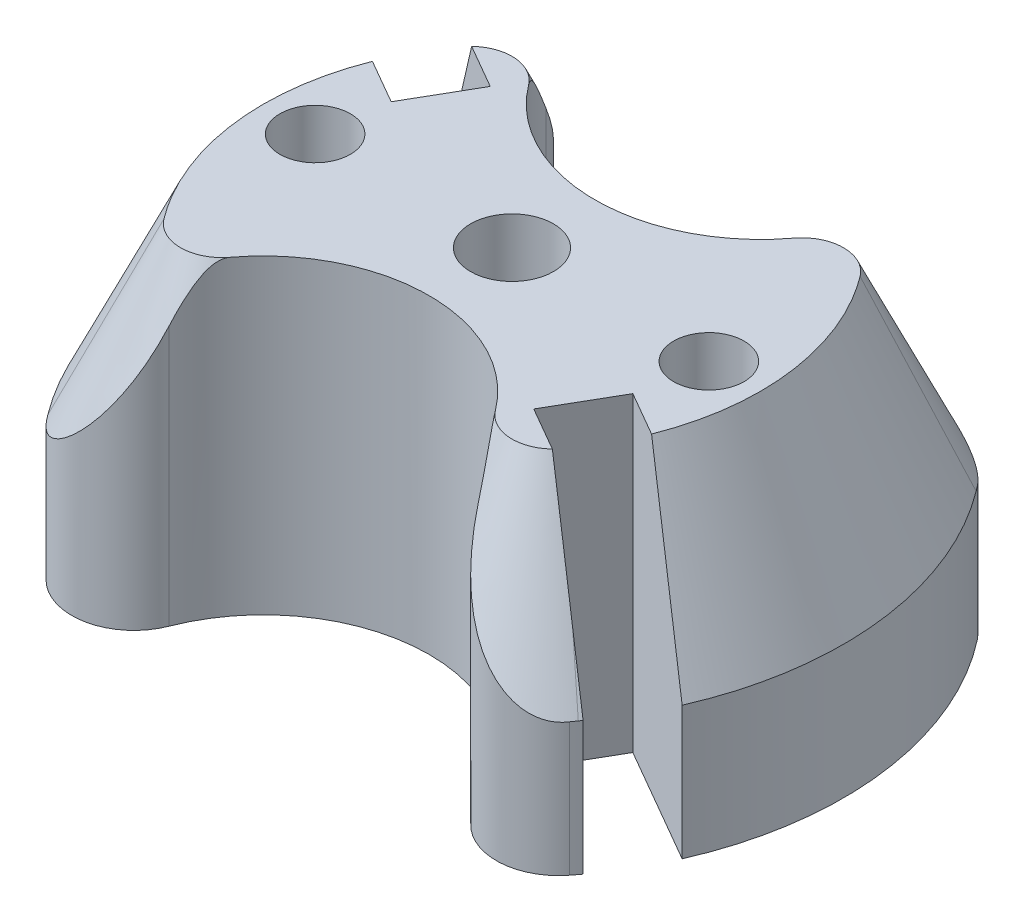
from build123d import *

# Parameters (mm, degrees)
BOSS_EXTRUDE1_DEPTH = 15
BOSS_EXTRUDE1_TAPER = -25
SKETCH2_R           = 2
CUT_EXTRUDE1_DEPTH  = 17
SKETCH3_R           = 32.062922841
CUT_EXTRUDE2_DEPTH  = 29.471632885
SKETCH1_3_R         = 1.7
CUT_EXTRUDE3_DEPTH  = 13


with BuildPart() as part:
    # Sketch1 → Boss-Extrude1 (new body)
    with BuildSketch(Plane(origin=(0, 0, 0), x_dir=(1, 0, 0), z_dir=(0, 1, 0))):
        with BuildLine():
            ThreePointArc((6.4, 7.2), (0, 4), (-6.4, 7.2))
            ThreePointArc((-6.4, 7.2), (-8, 8), (-9.6, 7.2))
            add(Edge.make_bspline(
                [(-9.6, 7.2), (-15, 0), (-9.6, -7.2)],
                knots=[2.498091545, 2.498091545, 2.498091545, 3.785093762, 3.785093762, 3.785093762], degree=2, weights=[1, 0.8, 1]))
            ThreePointArc((-9.6, -7.2), (-8, -8), (-6.4, -7.2))
            ThreePointArc((-6.4, -7.2), (0, -4), (6.4, -7.2))
            ThreePointArc((6.4, -7.2), (8, -8), (9.6, -7.2))
            add(Edge.make_bspline(
                [(9.6, -7.2), (15, 0), (9.6, 7.2)],
                knots=[5.639684198, 5.639684198, 5.639684198, 6.926686416, 6.926686416, 6.926686416], degree=2, weights=[1, 0.8, 1]))
            ThreePointArc((9.6, 7.2), (8, 8), (6.4, 7.2))
        make_face()
    extrude(amount=-BOSS_EXTRUDE1_DEPTH, taper=BOSS_EXTRUDE1_TAPER)

    # Sketch2 → Cut-Extrude1 (cut)
    with BuildSketch(Plane.XZ.offset(15)):
        Circle(SKETCH2_R)
    extrude(amount=-CUT_EXTRUDE1_DEPTH, mode=Mode.SUBTRACT)

    # Sketch3 → Cut-Extrude2 (cut, through all)
    with BuildSketch(Plane(origin=(0, 0, 0), x_dir=(1, 0, 0), z_dir=(0, 1, 0))):
        Circle(SKETCH3_R)
        with BuildLine():
            Line((9.015638796, -3.184455543), (7.265638796, -6.215544457))
            Line((7.265638796, -6.215544457), (12.898275754, -9.467548921))
            ThreePointArc((12.898275754, -9.467548921), (12.756358421, -9.657914881), (12.611631712, -9.846153846))
            ThreePointArc((12.611631712, -9.846153846), (9.812426671, -10.96836467), (7.45232783, -9.090909091))
            ThreePointArc((7.45232783, -9.090909091), (0, -4), (-7.45232783, -9.090909091))
            ThreePointArc((-7.45232783, -9.090909091), (-9.812426671, -10.96836467), (-12.611631712, -9.846153846))
            ThreePointArc((-12.611631712, -9.846153846), (-15.876287892, -1.985820424), (-14.648275754, 6.436460008))
            Line((-14.648275754, 6.436460008), (-9.015638796, 3.184455543))
            Line((-9.015638796, 3.184455543), (-7.265638796, 6.215544457))
            Line((-7.265638796, 6.215544457), (-12.898275754, 9.467548921))
            ThreePointArc((-12.898275754, 9.467548921), (-12.756358421, 9.657914881), (-12.611631712, 9.846153846))
            ThreePointArc((-12.611631712, 9.846153846), (-9.812426671, 10.96836467), (-7.45232783, 9.090909091))
            ThreePointArc((-7.45232783, 9.090909091), (0, 4), (7.45232783, 9.090909091))
            ThreePointArc((7.45232783, 9.090909091), (9.812426671, 10.96836467), (12.611631712, 9.846153846))
            ThreePointArc((12.611631712, 9.846153846), (15.876287892, 1.985820424), (14.648275754, -6.436460008))
            Line((14.648275754, -6.436460008), (11.156202507, -4.420310579))
            Line((11.156202507, -4.420310579), (9.015638796, -3.184455543))
        make_face(mode=Mode.SUBTRACT)
    extrude(amount=-CUT_EXTRUDE2_DEPTH, mode=Mode.SUBTRACT)

    # Sketch1<3> → Cut-Extrude3 (cut)
    with BuildSketch(Plane(origin=(0, 0, 0), x_dir=(1, 0, 0), z_dir=(0, 1, 0))):
        with Locations((-9.5, 0)):
            Circle(SKETCH1_3_R)
        with Locations((9.5, 0)):
            Circle(SKETCH1_3_R)
    extrude(amount=-CUT_EXTRUDE3_DEPTH, mode=Mode.SUBTRACT)


solid = part.part
